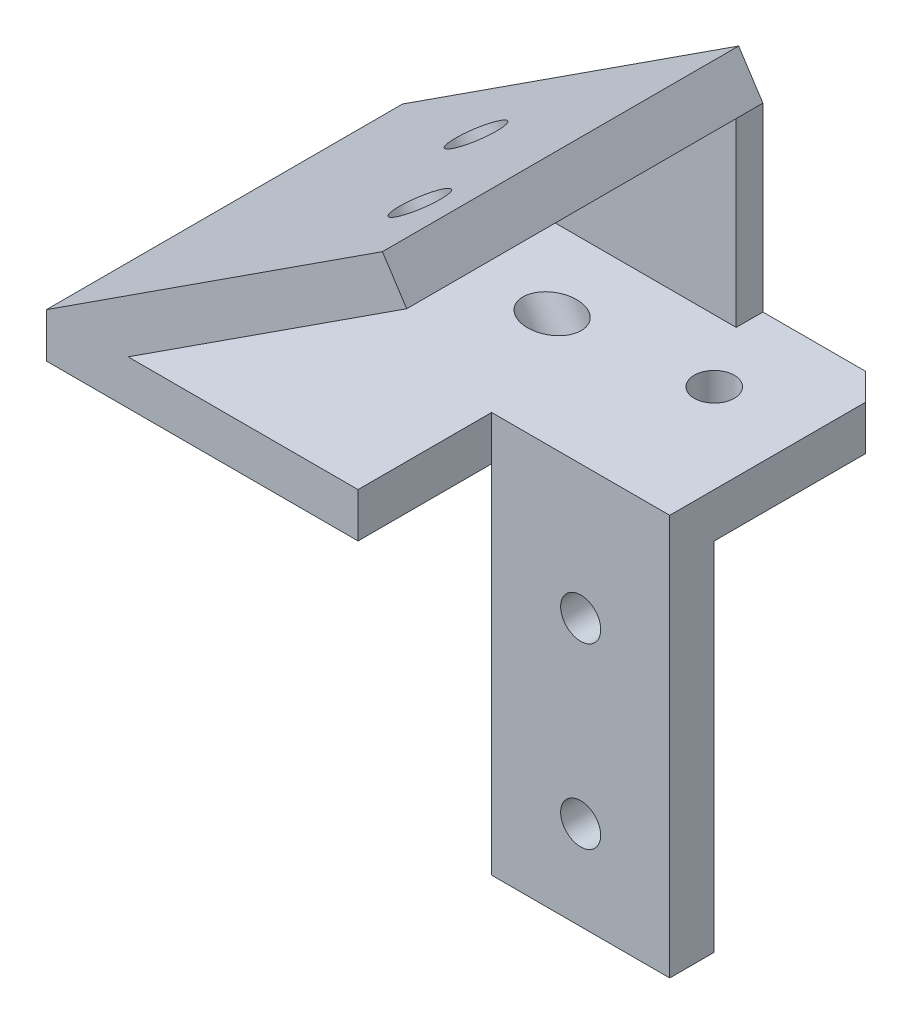
from build123d import *

# Parameters (mm, degrees)
SKETCH1_W           = 20
SKETCH1_H           = 20
SKETCH1_R           = 2.25
BOSS_EXTRUDE1_DEPTH = 5
SKETCH2_W           = 20
SKETCH2_H           = 45
SKETCH2_R           = 2.25
BOSS_EXTRUDE2_DEPTH = 5
CHAMFER1_SIZE       = 3
SKETCH3_W           = 40
SKETCH3_H           = 5
BOSS_EXTRUDE3_DEPTH = 35
BOSS_EXTRUDE4_DEPTH = 40
BOSS_EXTRUDE5_DEPTH = 3
SKETCH6_R           = 2.75
CUT_EXTRUDE1_DEPTH  = 71.765657873


with BuildPart() as part:
    # Sketch1 → Boss-Extrude1 (new body)
    with BuildSketch(Plane(origin=(0, 0, 0), x_dir=(1, 0, 0), z_dir=(0, 1, 0))):
        with Locations((10, 10)):
            Rectangle(SKETCH1_W, SKETCH1_H)
        with Locations((10, 10)):
            Circle(SKETCH1_R, mode=Mode.SUBTRACT)
    extrude(amount=BOSS_EXTRUDE1_DEPTH)

    # Sketch2 → Boss-Extrude2 (add)
    with BuildSketch(Plane.XY):
        with Locations((10, -17.5)):
            Rectangle(SKETCH2_W, SKETCH2_H)
        with Locations((10, -30)):
            Circle(SKETCH2_R, mode=Mode.SUBTRACT)
        with Locations((10, -10)):
            Circle(SKETCH2_R, mode=Mode.SUBTRACT)
    extrude(amount=BOSS_EXTRUDE2_DEPTH)

    # Chamfer1
    chamfer1_edges = [part.edges().sort_by_distance(p)[0] for p in [
        (20, 2.5, -20),
    ]]
    chamfer(chamfer1_edges, length=CHAMFER1_SIZE)

    # Sketch3 → Boss-Extrude3 (add)
    with BuildSketch(Plane.ZY):
        with Locations((0, 2.5)):
            Rectangle(SKETCH3_W, SKETCH3_H)
    extrude(amount=BOSS_EXTRUDE3_DEPTH)

    # Sketch4 → Boss-Extrude4 (add)
    with BuildSketch(Plane.XY.offset(20)):
        Polygon((-35, 5), (2.740175558, 29.508756576), (5.463370733, 25.315403736), (-25.819607706, 5), align=None)
    extrude(amount=-BOSS_EXTRUDE4_DEPTH)

    # Sketch5 → Boss-Extrude5 (add)
    with BuildSketch(Plane(origin=(0, 0, -20), x_dir=(-1, 0, 0), z_dir=(0, 0, -1))):
        Polygon((-5.463370733, 25.315403736), (-5.463370733, 5), (25.819607706, 5), align=None)
    extrude(amount=-BOSS_EXTRUDE5_DEPTH)

    # Sketch6 → Cut-Extrude1 (cut, through all)
    with BuildSketch(Plane(origin=(-12.66597239, 19.503887116, 0), x_dir=(0.8386705679454272, 0.5446390350150224, 0), z_dir=(-0.5446390350150224, 0.8386705679454272, 0))):
        with Locations((9.369725297, -8.25)):
            Circle(SKETCH6_R)
        with Locations((-2.480274703, 8)):
            Circle(SKETCH6_R)
    extrude(amount=-CUT_EXTRUDE1_DEPTH, mode=Mode.SUBTRACT)


solid = part.part
